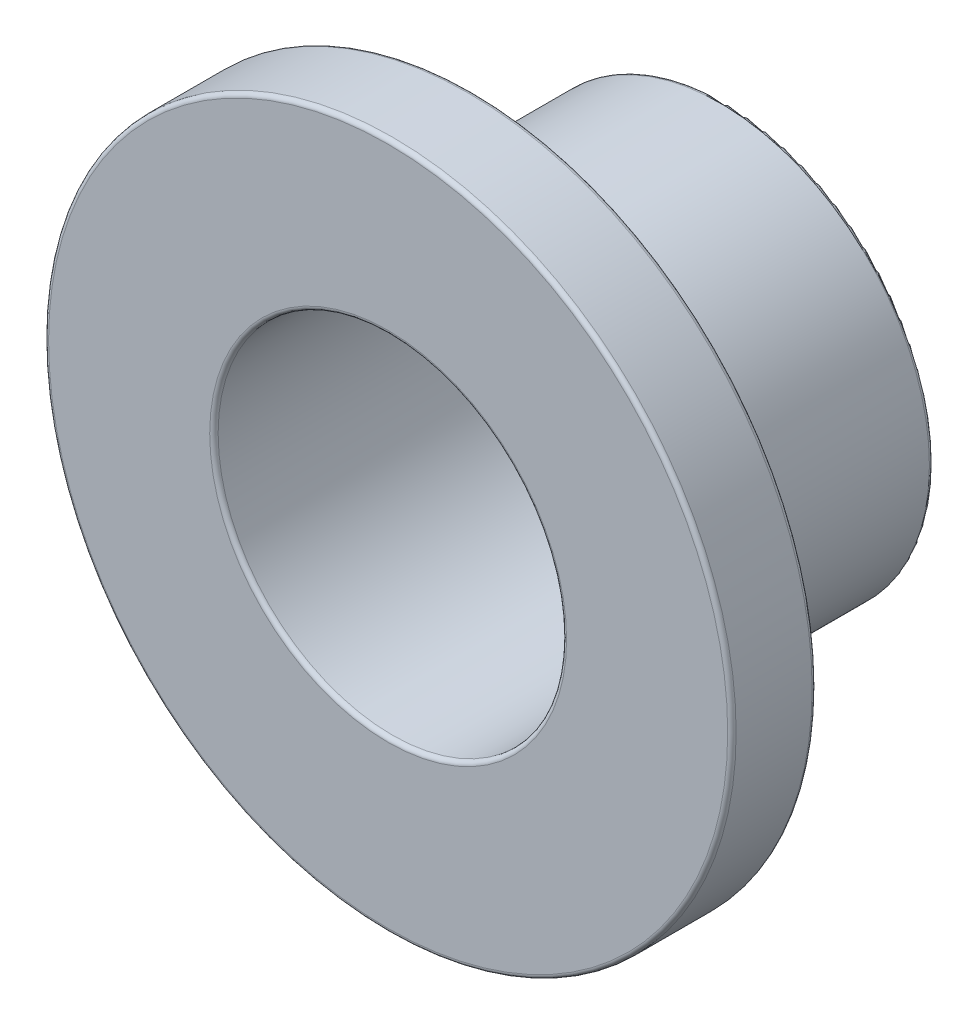
from build123d import *

# Parameters (mm, degrees)
FILLET1_R = 0.08001


with BuildPart() as part:
    # Sketch2 → Revolve1 (revolve)
    with BuildSketch(Plane(origin=(0, 0, 0), x_dir=(0, 0, -1), z_dir=(1, 0, 0))):
        Polygon((-3.1877, 3.302), (3.1877, 3.302), (3.1877, 3.9624), (-1.5875, 3.9624), (-1.5875, 6.5151), (-3.1877, 6.5151), align=None)
    revolve(axis=Axis((0, 0, 3.1877), (0, 0, -1)))

    # Fillet1
    fillet1_edges = [part.edges().sort_by_distance(p)[0] for p in [
        (0, -3.302, 3.1877),
        (0, -3.302, -3.1877),
        (0, -3.9624, -3.1877),
        (0, -3.9624, 1.5875),
        (0, -6.5151, 1.5875),
        (0, -6.5151, 3.1877),
    ]]
    fillet(fillet1_edges, radius=FILLET1_R)


solid = part.part
